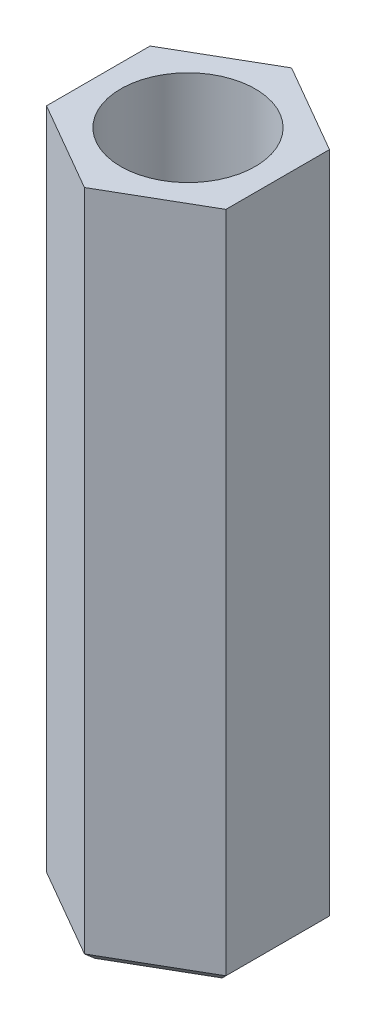
from build123d import *

# Parameters (mm, degrees)
ESQUISSE1_R        = 1.5
BOSS_EXTRU_1_DEPTH = 15
CHANFREIN1_SIZE    = 0.2


with BuildPart() as part:
    # Esquisse1 → Boss.-Extru.1 (new body)
    with BuildSketch(Plane(origin=(0, 0, 0), x_dir=(1, 0, 0), z_dir=(0, 1, 0))):
        Polygon((0, -2.309401077), (2, -1.154700538), (2, 1.154700538), (0, 2.309401077), (-2, 1.154700538), (-2, -1.154700538), align=None)
        Circle(ESQUISSE1_R, mode=Mode.SUBTRACT)
    extrude(amount=BOSS_EXTRU_1_DEPTH)

    # Chanfrein1
    chanfrein1_edges = [part.edges().sort_by_distance(p)[0] for p in [
        (-1.5, 0, 0),
        (1, 0, 1.732050808),
        (2, 0, 0),
        (1, 0, -1.732050808),
        (-1, 0, -1.732050808),
        (-2, 0, 0),
        (-1, 0, 1.732050808),
    ]]
    chamfer(chanfrein1_edges, length=CHANFREIN1_SIZE)


solid = part.part
